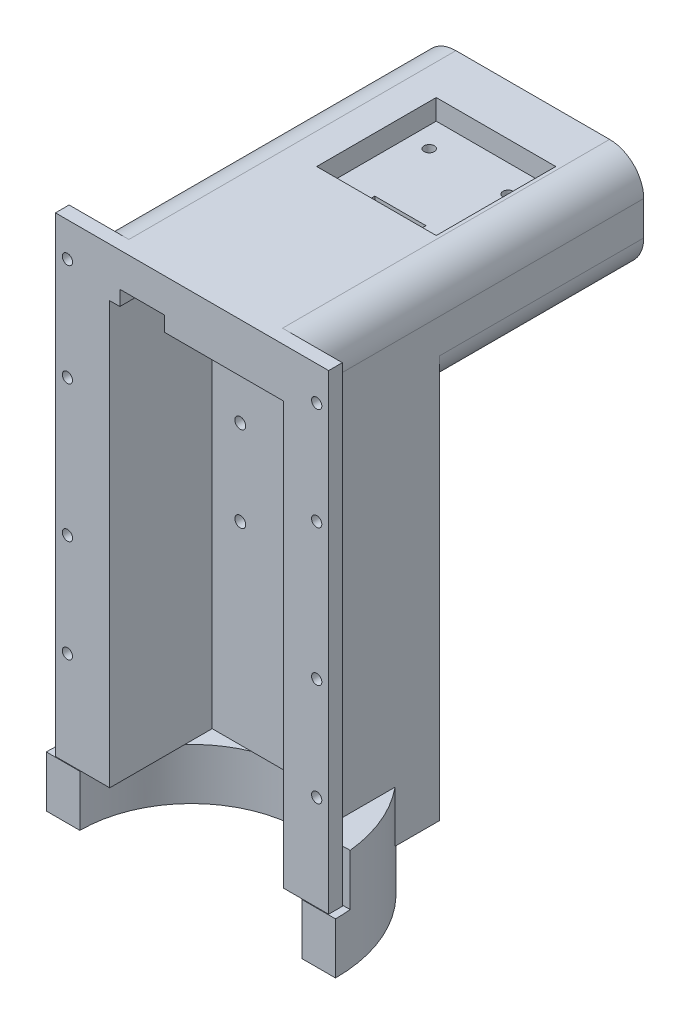
from build123d import *

# Parameters (mm, degrees)
SKETCH_1_W           = 158.76721969
SKETCH_1_H           = 156
EXTRUDE_1_DEPTH      = 65
SKETCH_2_W           = 158.85328248
SKETCH_2_H           = 116
CUT_EXTRUDE_1_DEPTH  = 175.106359002
SKETCH_3_W           = 50.908374927
SKETCH_3_H           = 145.199783254
CUT_EXTRUDE_2_DEPTH  = 30
SKETCH_4_W           = 35
SKETCH_4_H           = 35
CUT_EXTRUDE_3_DEPTH  = 6
SKETCH_5_W           = 15
SKETCH_5_H           = 7
CUT_EXTRUDE_4_DEPTH  = 30
SKETCH_6_W           = 16.173646408
SKETCH_6_H           = 21.728169507
CUT_EXTRUDE_5_DEPTH  = 10
SKETCH_12_W          = 86.243953328
SKETCH_12_H          = 39.310546327
CUT_EXTRUDE_8_DEPTH  = 175.106359002
SKETCH_9_W           = 48
SKETCH_9_H           = 24
CUT_EXTRUDE_6_DEPTH  = 65
SKETCH_10_W          = 13
SKETCH_10_H          = 21.606977086
CUT_EXTRUDE_7_DEPTH  = 142
SKETCH_14_W          = 115.071710401
SKETCH_14_H          = 109.204529419
CUT_EXTRUDE_9_DEPTH  = 183.843220343
SKETCH_17_W          = 7.5
SKETCH_17_H          = 137.87
EXTRUDE_2_DEPTH      = 4
SKETCH_16_R          = 1.5
CUT_EXTRUDE_10_DEPTH = 182.230387146
SKETCH_18_W          = 105.560370757
SKETCH_18_H          = 69.761390661
CUT_EXTRUDE_11_DEPTH = 10
SKETCH_20_W          = 34.311797321
SKETCH_20_H          = 49.303612094
CUT_EXTRUDE_12_DEPTH = 20
SKETCH_21_R          = 1.5
CUT_EXTRUDE_13_DEPTH = 15
SKETCH_22_W          = 34.558218505
SKETCH_22_H          = 17.119534262
CUT_EXTRUDE_14_DEPTH = 15
SKETCH_23_R          = 1.5
CUT_EXTRUDE_15_DEPTH = 15
SKETCH_28_R          = 1.6
CUT_EXTRUDE_17_DEPTH = 10
FILLET_5_R           = 10
FILLET_6_R           = 10
SKETCH_24_R          = 42.345367042
SKETCH_24_R_2        = 32.5
EXTRUDE_3_DEPTH      = 15
EXTRUDE_START        = 15
EXTRUDE_4_DEPTH      = 15
EXTRUDE_5_DEPTH      = 15
SKETCH_31_W          = 132.972003353
SKETCH_31_H          = 50.361945542
CUT_EXTRUDE_18_DEPTH = 15


with BuildPart() as part:
    # 草图1 → 凸台-拉伸1 (new body)
    with BuildSketch(Plane(origin=(0, 0, 0), x_dir=(0, 0, -1), z_dir=(1, 0, 0))):
        with Locations((-21.604044476, 48.053631124)):
            Rectangle(SKETCH_1_W, SKETCH_1_H)
    extrude(amount=EXTRUDE_1_DEPTH)

    # 草图2 → 切除-拉伸1 (cut, through all)
    with BuildSketch(Plane(origin=(65, 0, 0), x_dir=(0, 0, -1), z_dir=(1, 0, 0))):
        with Locations((18.438986919, 28.053631124)):
            Rectangle(SKETCH_2_W, SKETCH_2_H)
    extrude(amount=-CUT_EXTRUDE_1_DEPTH, mode=Mode.SUBTRACT)

    # 草图3 → 切除-拉伸2 (cut)
    with BuildSketch(Plane.XY.offset(100.987654321)):
        with Locations((33.848978786, 39.12697696)):
            Rectangle(SKETCH_3_W, SKETCH_3_H)
    extrude(amount=-CUT_EXTRUDE_2_DEPTH, mode=Mode.SUBTRACT)

    # 草图4 → 切除-拉伸3 (cut)
    with BuildSketch(Plane(origin=(0, 126.053631124, 0), x_dir=(1, 0, 0), z_dir=(0, 1, 0))):
        with Locations((36.50386385, -33.487654321)):
            Rectangle(SKETCH_4_W, SKETCH_4_H)
    extrude(amount=-CUT_EXTRUDE_3_DEPTH, mode=Mode.SUBTRACT)

    # 草图5 → 切除-拉伸4 (cut)
    with BuildSketch(Plane(origin=(0, 120.053631124, 0), x_dir=(1, 0, 0), z_dir=(0, 1, 0))):
        with Locations((36.50386385, -47.487654321)):
            Rectangle(SKETCH_5_W, SKETCH_5_H)
    extrude(amount=-CUT_EXTRUDE_4_DEPTH, mode=Mode.SUBTRACT)

    # 草图6 → 切除-拉伸5 (cut)
    with BuildSketch(Plane.XY.offset(70.987654321)):
        with Locations((36.425330815, 100.862783834)):
            Rectangle(SKETCH_6_W, SKETCH_6_H)
    extrude(amount=-CUT_EXTRUDE_5_DEPTH, mode=Mode.SUBTRACT)

    # 草图12 → 切除-拉伸8 (cut, through all)
    with BuildSketch(Plane(origin=(65, 0, 0), x_dir=(0, 0, -1), z_dir=(1, 0, 0))):
        with Locations((-69.77461077, -31.47164204)):
            Rectangle(SKETCH_12_W, SKETCH_12_H)
    extrude(amount=-CUT_EXTRUDE_8_DEPTH, mode=Mode.SUBTRACT)

    # 草图9 → 切除-拉伸6 (cut)
    with BuildSketch(Plane(origin=(0, 0, -57.779565369), x_dir=(-1, 0, 0), z_dir=(0, 0, -1))):
        with Locations((-35.359469061, 106.501927087)):
            Rectangle(SKETCH_9_W, SKETCH_9_H)
    extrude(amount=-CUT_EXTRUDE_6_DEPTH, mode=Mode.SUBTRACT)

    # 草图10 → 切除-拉伸7 (cut)
    with BuildSketch(Plane(origin=(0, 0, 7.220434631), x_dir=(-1, 0, 0), z_dir=(0, 0, -1))):
        with Locations((-17.859469061, 105.30541563)):
            Rectangle(SKETCH_10_W, SKETCH_10_H)
    extrude(amount=-CUT_EXTRUDE_7_DEPTH, mode=Mode.SUBTRACT)

    # 草图14 → 切除-拉伸9 (cut, through all)
    with BuildSketch(Plane(origin=(0, 126.053631124, 0), x_dir=(1, 0, 0), z_dir=(0, 1, 0))):
        with Locations((38.012225103, 53.381830079)):
            Rectangle(SKETCH_14_W, SKETCH_14_H)
    extrude(amount=-CUT_EXTRUDE_9_DEPTH, mode=Mode.SUBTRACT)

    # 草图17 → 凸台-拉伸2 (add)
    with BuildSketch(Plane.XY.offset(100.987654321)):
        with Locations((-3.75, 57.118631124)):
            Rectangle(SKETCH_17_W, SKETCH_17_H)
        with Locations((68.75, 57.118631124)):
            Rectangle(SKETCH_17_W, SKETCH_17_H)
    extrude(amount=-EXTRUDE_2_DEPTH)

    # 草图16 → 切除-拉伸10 (cut, through all)
    with BuildSketch(Plane(origin=(0, 120.053631124, 0), x_dir=(1, 0, 0), z_dir=(0, 1, 0))):
        with Locations(Location((24.95386385, -46.987654321, 0), (0, 0, 270))):
            Circle(SKETCH_16_R)
        with Locations(Location((48.05386385, -46.987654321, 0), (0, 0, 270))):
            Circle(SKETCH_16_R)
        with Locations(Location((24.95386385, -23.987654321, 0), (0, 0, 270))):
            Circle(SKETCH_16_R)
        with Locations(Location((48.05386385, -23.987654321, 0), (0, 0, 270))):
            Circle(SKETCH_16_R)
    extrude(amount=-CUT_EXTRUDE_10_DEPTH, mode=Mode.SUBTRACT)

    # 草图18 → 切除-拉伸11 (cut)
    with BuildSketch(Plane.XZ.offset(-86.053631124)):
        with Locations((39.446315854, 26.113971664)):
            Rectangle(SKETCH_18_W, SKETCH_18_H)
    extrude(amount=-CUT_EXTRUDE_11_DEPTH, mode=Mode.SUBTRACT)

    # 草图20 → 切除-拉伸12 (cut)
    with BuildSketch(Plane.XZ.offset(-96.053631124)):
        with Locations((41.515367722, 36.342860947)):
            Rectangle(SKETCH_20_W, SKETCH_20_H)
    extrude(amount=-CUT_EXTRUDE_12_DEPTH, mode=Mode.SUBTRACT)

    # 草图21 → 切除-拉伸13 (cut)
    with BuildSketch(Plane(origin=(0, 0, 7.220434631), x_dir=(-1, 0, 0), z_dir=(0, 0, -1))):
        with Locations((-52.200258978, 114.424449587)):
            Circle(SKETCH_21_R)
        with Locations((-52.210974666, 99.924453546)):
            Circle(SKETCH_21_R)
    extrude(amount=-CUT_EXTRUDE_13_DEPTH, mode=Mode.SUBTRACT)

    # 草图22 → 切除-拉伸14 (cut)
    with BuildSketch(Plane.XY.offset(70.987654321)):
        with Locations((41.638578314, 103.167101456)):
            Rectangle(SKETCH_22_W, SKETCH_22_H)
    extrude(amount=-CUT_EXTRUDE_14_DEPTH, mode=Mode.SUBTRACT)

    # 草图23 → 切除-拉伸15 (cut)
    with BuildSketch(Plane.XY.offset(100.987654321)):
        with Locations((69, 116.053631124)):
            Circle(SKETCH_23_R)
        with Locations((69, 86.053631124)):
            Circle(SKETCH_23_R)
        with Locations((69, 46.053631124)):
            Circle(SKETCH_23_R)
        with Locations((69, 16.053631124)):
            Circle(SKETCH_23_R)
        with Locations((-4, 116.053631124)):
            Circle(SKETCH_23_R)
        with Locations((-4, 86.053631124)):
            Circle(SKETCH_23_R)
        with Locations((-4, 46.053631124)):
            Circle(SKETCH_23_R)
        with Locations((-4, 16.053631124)):
            Circle(SKETCH_23_R)
    extrude(amount=-CUT_EXTRUDE_15_DEPTH, mode=Mode.SUBTRACT)

    # 草图28 → 切除-拉伸17 (cut)
    with BuildSketch(Plane.XY.offset(70.987654321)):
        with Locations((16.622657387, 69.823755444)):
            Circle(SKETCH_28_R)
        with Locations((52.182657387, 69.823755444)):
            Circle(SKETCH_28_R)
        with Locations((16.622657387, 44.803755444)):
            Circle(SKETCH_28_R)
        with Locations((52.182657387, 44.803755444)):
            Circle(SKETCH_28_R)
    extrude(amount=-CUT_EXTRUDE_17_DEPTH, mode=Mode.SUBTRACT)

    # 圆角5
    fillet_5_edges = [part.edges().sort_by_distance(p)[0] for p in [
        (0, 126.053631124, 49.104044476),
        (65, 126.053631124, 49.104044476),
    ]]
    fillet(fillet_5_edges, radius=FILLET_5_R)

    # 圆角6
    # the kernel refuses this fillet: 10 mm, written as the material it takes off along each edge
    with BuildSketch(Plane(origin=(65, 96.053631124, 60.994666994), x_dir=(-1, 0, 0), z_dir=(0, 0, -1)), Plane(origin=(0, 96.053631124, 60.994666994), x_dir=(0, 1, 0), z_dir=(0, 0, -1))) as fillet_6_piece_1:
        with BuildLine():
            CenterArc((FILLET_6_R, FILLET_6_R), FILLET_6_R, 180, 90)
            Line((0, FILLET_6_R), (0, 0))
            Line((0, 0), (FILLET_6_R, 0))
        make_face()
    extrude(amount=84.774232362, mode=Mode.SUBTRACT)

    # 草图24 → 凸台-拉伸3 (add)
    with BuildSketch(Plane.XZ.offset(11.816368876)):
        with Locations(Location((32.330540247, 100.987654321, 0), (0, 0, 320.488798593))):
            Circle(SKETCH_24_R)
        with Locations((32.330540247, 100.987654321)):
            Circle(SKETCH_24_R_2, mode=Mode.SUBTRACT)
    extrude(amount=EXTRUDE_3_DEPTH)

    # 草图29 → 凸台-拉伸4 (add)
    with BuildSketch(Plane(origin=(0, -11.816368876, 0), x_dir=(1, 0, 0), z_dir=(0, 1, 0)).offset(EXTRUDE_START)):
        with BuildLine():
            Line((0, -73.640510462), (0, -96.784474951))
            Line((0, -96.784474951), (-9.805707724, -96.784474951))
            ThreePointArc((-9.805707724, -96.784474951), (-6.659668908, -84.468159778), (0, -73.640510462))
        make_face()
    extrude(amount=-EXTRUDE_4_DEPTH)

    # 草图30 → 凸台-拉伸5 (add)
    with BuildSketch(Plane(origin=(0, -11.816368876, 0), x_dir=(1, 0, 0), z_dir=(0, 1, 0)).offset(EXTRUDE_START)):
        with BuildLine():
            Line((74.449305819, -96.612760422), (65, -96.987654321))
            Line((65, -96.987654321), (65, -74.046301175))
            ThreePointArc((65, -74.046301175), (71.389866055, -84.632252236), (74.449305819, -96.612760422))
        make_face()
    extrude(amount=-EXTRUDE_5_DEPTH)

    # 草图31 → 切除-拉伸18 (cut)
    with BuildSketch(Plane(origin=(0, -11.816368876, 0), x_dir=(1, 0, 0), z_dir=(0, 1, 0))):
        with Locations((46.807884266, -126.3437758)):
            Rectangle(SKETCH_31_W, SKETCH_31_H)
    extrude(amount=-CUT_EXTRUDE_18_DEPTH, mode=Mode.SUBTRACT)


solid = part.part
